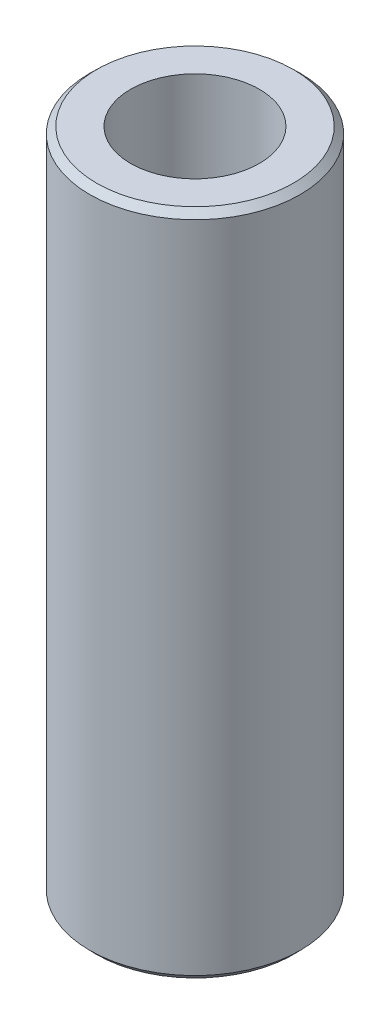
from build123d import *
from OCP.BRepFilletAPI import BRepFilletAPI_MakeChamfer

# Parameters (mm, degrees)
SKETCH1_R           = 7.5
BOSS_EXTRUDE1_DEPTH = 47.62381201
SKETCH2_R           = 4.589632316
CUT_EXTRUDE1_DEPTH  = 49.790649415
CHAMFER1_SIZE       = 0.466146186
CHAMFER1_SIZE2      = 0.479885177


with BuildPart() as part:
    # Sketch1 → Boss-Extrude1 (new body)
    with BuildSketch(Plane(origin=(0, 0, 0), x_dir=(1, 0, 0), z_dir=(0, 1, 0))):
        Circle(SKETCH1_R)
    extrude(amount=BOSS_EXTRUDE1_DEPTH)

    # Sketch2 → Cut-Extrude1 (cut, through all)
    with BuildSketch(Plane(origin=(0, 0, 0), x_dir=(1, 0, 0), z_dir=(0, 1, 0))):
        Circle(SKETCH2_R)
    extrude(amount=CUT_EXTRUDE1_DEPTH, mode=Mode.SUBTRACT)

    # Chamfer1: one chamfer whose edges measure the first distance from different faces: ONE call of the kernel's chamfer builder (chamfer() names one face for all edges)
    chamfer1_edges_1 = [part.edges().sort_by_distance(p)[0] for p in [
        (-7.5, 47.62381201, 0),
    ]]
    chamfer1_side_1 = [part.faces().sort_by_distance(p)[0] for p in [
        (-7.5, 23.811906005, 0),
    ]]
    chamfer1_edges_2 = [part.edges().sort_by_distance(p)[0] for p in [
        (-7.5, 0, 0),
    ]]
    chamfer1_side_2 = [part.faces().sort_by_distance(p)[0] for p in [
        (-7.287867966, 0, 0),
    ]]
    chamfer1 = BRepFilletAPI_MakeChamfer(part.part.solid().wrapped)
    for e in chamfer1_edges_1:
        chamfer1.Add(CHAMFER1_SIZE, CHAMFER1_SIZE2, e.wrapped, chamfer1_side_1[0].wrapped)  # the first distance lies on this face
    for e in chamfer1_edges_2:
        chamfer1.Add(CHAMFER1_SIZE, CHAMFER1_SIZE2, e.wrapped, chamfer1_side_2[0].wrapped)  # the first distance lies on this face
    add(Compound.cast(chamfer1.Shape()), mode=Mode.REPLACE)


solid = part.part
